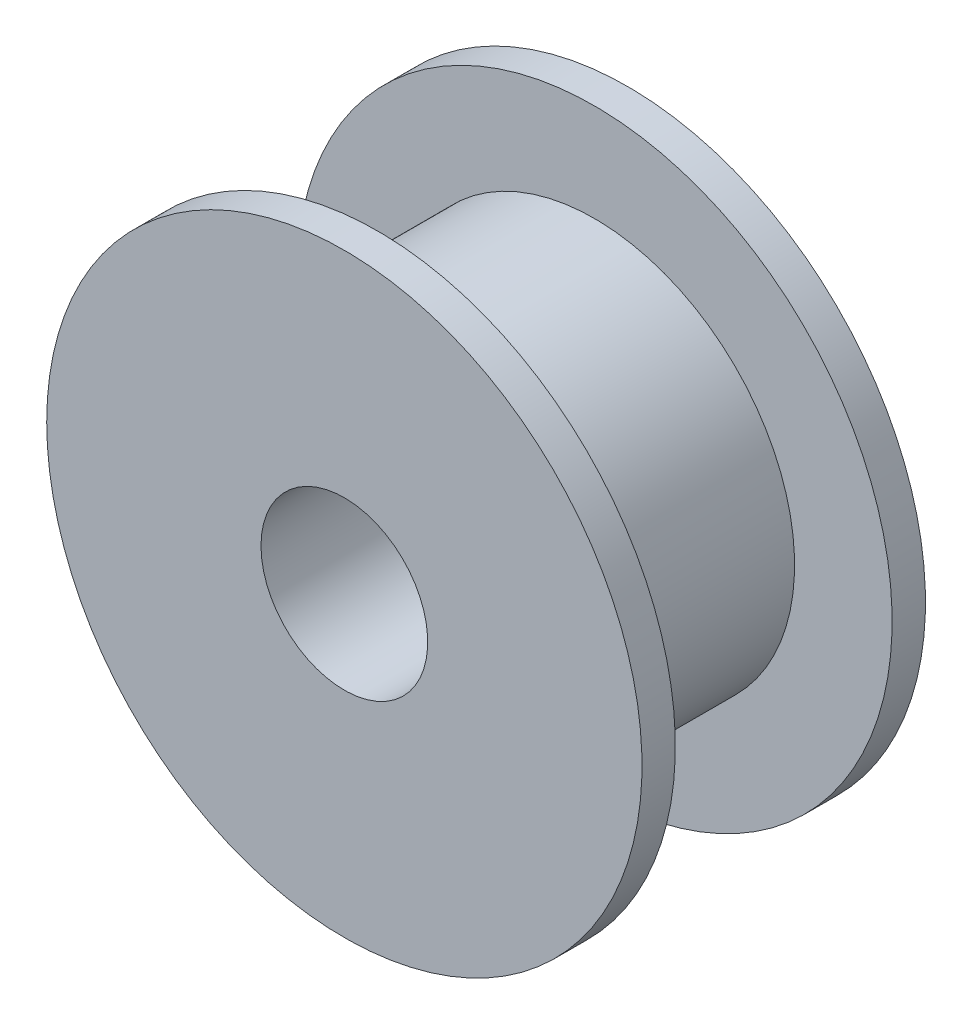
from build123d import *

# Parameters (mm, degrees)
SKETCH6_R           = 6
BOSS_EXTRUDE1_DEPTH = 3.25
SKETCH8_R           = 8.925
BOSS_EXTRUDE2_DEPTH = 1
SKETCH9_R           = 2.5
CUT_EXTRUDE1_DEPTH  = 14.318173674


with BuildPart() as part:
    # Sketch6 → Boss-Extrude1 (new body)
    with BuildSketch(Plane.XY):
        Circle(SKETCH6_R)
    boss_extrude1 = extrude(amount=BOSS_EXTRUDE1_DEPTH)

    # Sketch8 → Boss-Extrude2 (add)
    with BuildSketch(Plane(origin=(0, 0, 0), x_dir=(-1, 0, 0), z_dir=(0, 0, -1))):
        Circle(SKETCH8_R)
    boss_extrude2 = extrude(amount=BOSS_EXTRUDE2_DEPTH)

    # Sketch9 → Cut-Extrude1 (cut, through all)
    with BuildSketch(Plane(origin=(0, 0, -1), x_dir=(-1, 0, 0), z_dir=(0, 0, -1))):
        Circle(SKETCH9_R)
    cut_extrude1 = extrude(amount=-CUT_EXTRUDE1_DEPTH, mode=Mode.SUBTRACT)

    # Mirror2: Boss-Extrude1, Boss-Extrude2, Cut-Extrude1 across plane
    add(boss_extrude1.mirror(Plane.XY.offset(3.25)))
    add(boss_extrude2.mirror(Plane.XY.offset(3.25)))
    add(cut_extrude1.mirror(Plane.XY.offset(3.25)), mode=Mode.SUBTRACT)


solid = part.part
